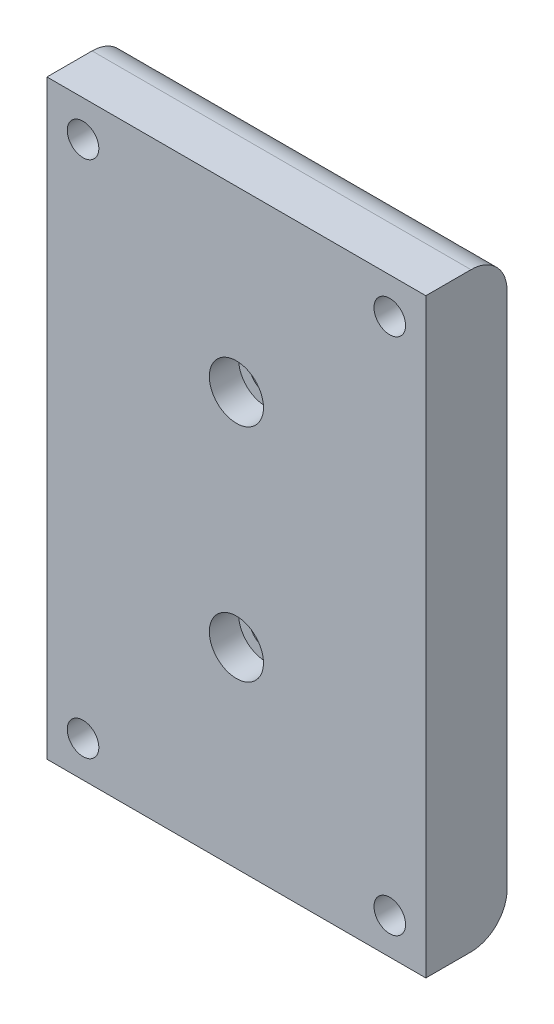
from build123d import *

# Parameters (mm, degrees)
SKETCH1_W           = 42
SKETCH1_H           = 65.5
BOSS_EXTRUDE1_DEPTH = 9
CUT_EXTRUDE2_DEPTH  = 4.5
SKETCH3_R           = 1.75
CUT_EXTRUDE5_DEPTH  = 78.939078773
SKETCH5_R           = 3
CUT_EXTRUDE6_DEPTH  = 3.25
FILLET1_R           = 4
SKETCH6_R           = 1.75
CUT_EXTRUDE7_DEPTH  = 79.327836687
SKETCH7_R           = 3
CUT_EXTRUDE8_DEPTH  = 3


with BuildPart() as part:
    # Sketch1 → Boss-Extrude1 (new body)
    with BuildSketch(Plane.XY):
        with Locations((21, 32.75)):
            Rectangle(SKETCH1_W, SKETCH1_H)
    extrude(amount=BOSS_EXTRUDE1_DEPTH)

    # Sketch2 → Cut-Extrude2 (cut)
    with BuildSketch(Plane(origin=(0, 0, 0), x_dir=(-1, 0, 0), z_dir=(0, 0, -1))):
        with BuildLine():
            Line((-25.5, 21.25), (-25.5, 35.084635496))
            ThreePointArc((-25.5, 35.084635496), (-25.998538124, 38.202683318), (-27.444444444, 41.009837998))
            ThreePointArc((-27.444444444, 41.009837998), (-21, 53.75), (-14.555555556, 41.009837998))
            ThreePointArc((-14.555555556, 41.009837998), (-16.001461876, 38.202683318), (-16.5, 35.084635496))
            Line((-16.5, 35.084635496), (-16.5, 21.25))
            ThreePointArc((-16.5, 21.25), (-21, 16.75), (-25.5, 21.25))
        make_face()
    extrude(amount=-CUT_EXTRUDE2_DEPTH, mode=Mode.SUBTRACT)

    # Sketch3 → Cut-Extrude5 (cut, through all)
    with BuildSketch(Plane(origin=(0, 0, 4.5), x_dir=(-1, 0, 0), z_dir=(0, 0, -1))):
        with Locations((-21, 21.25)):
            Circle(SKETCH3_R)
        with Locations((-21, 45.75)):
            Circle(SKETCH3_R)
    extrude(amount=-CUT_EXTRUDE5_DEPTH, mode=Mode.SUBTRACT)

    # Sketch5 → Cut-Extrude6 (cut)
    with BuildSketch(Plane.XY.offset(9)):
        with Locations((21, 21.25)):
            Circle(SKETCH5_R)
        with Locations((21, 45.75)):
            Circle(SKETCH5_R)
    extrude(amount=-CUT_EXTRUDE6_DEPTH, mode=Mode.SUBTRACT)

    # Fillet1
    fillet1_edges = [part.edges().sort_by_distance(p)[0] for p in [
        (21, 0, 0),
        (21, 65.5, 0),
    ]]
    fillet(fillet1_edges, radius=FILLET1_R)

    # Sketch6 → Cut-Extrude7 (cut, through all)
    with BuildSketch(Plane(origin=(0, 0, 0), x_dir=(-1, 0, 0), z_dir=(0, 0, -1))):
        with Locations((-38, 61.5)):
            Circle(SKETCH6_R)
        with Locations((-4, 61.5)):
            Circle(SKETCH6_R)
        with Locations((-4, 4)):
            Circle(SKETCH6_R)
        with Locations((-38, 4)):
            Circle(SKETCH6_R)
    extrude(amount=-CUT_EXTRUDE7_DEPTH, mode=Mode.SUBTRACT)

    # Sketch7 → Cut-Extrude8 (cut)
    with BuildSketch(Plane(origin=(0, 0, 0), x_dir=(-1, 0, 0), z_dir=(0, 0, -1))):
        with Locations((-38, 61.5)):
            Circle(SKETCH7_R)
        with Locations((-4, 61.5)):
            Circle(SKETCH7_R)
        with Locations((-4, 4)):
            Circle(SKETCH7_R)
        with Locations((-38, 4)):
            Circle(SKETCH7_R)
    extrude(amount=-CUT_EXTRUDE8_DEPTH, mode=Mode.SUBTRACT)


solid = part.part
